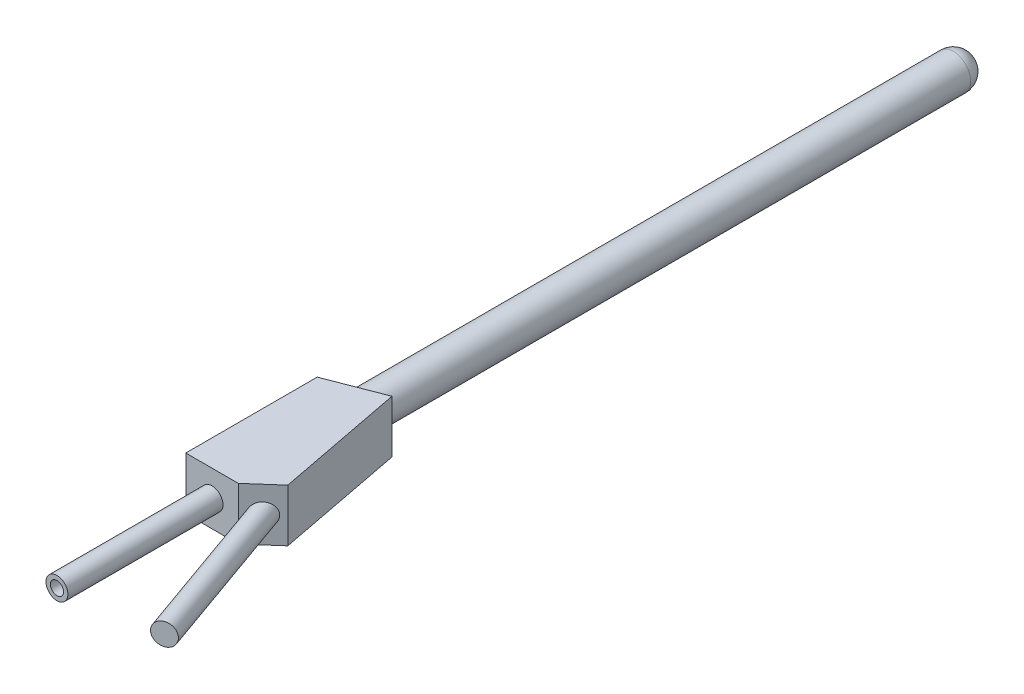
from build123d import *

# Parameters (mm, degrees)
BOSS_EXTRUDE1_DEPTH = 6
SKETCH4_R           = 2
BOSS_EXTRUDE2_DEPTH = 71.5
FILLET1_R           = 2
SKETCH5_R           = 1.25
BOSS_EXTRUDE3_DEPTH = 17.7
SHELL1_T            = -0.5
SKETCH7_R           = 1.25
BOSS_EXTRUDE4_DEPTH = 18.5
BOSS_EXTRUDE5_START = -5
SKETCH7_2_R         = 1.25
BOSS_EXTRUDE5_DEPTH = 5


with BuildPart() as part:
    # Sketch1 → Boss-Extrude1 (new body)
    with BuildSketch(Plane(origin=(0, 0, 0), x_dir=(1, 0, 0), z_dir=(0, 1, 0))):
        Polygon((0, 0), (6.158217776, 2.374100634), (9, -12.354248689), (6, -15), (0, -15), align=None)
    extrude(amount=BOSS_EXTRUDE1_DEPTH)

    # Sketch4 → Boss-Extrude2 (add)
    with BuildSketch(Plane.XY):
        with Locations((3.079108888, 3)):
            Circle(SKETCH4_R)
    extrude(amount=-BOSS_EXTRUDE2_DEPTH)

    # Fillet1
    fillet1_edges = [part.edges().sort_by_distance(p)[0] for p in [
        (1.079108888, 3, -71.5),
    ]]
    fillet(fillet1_edges, radius=FILLET1_R)

    # Sketch5 → Boss-Extrude3 (add)
    with BuildSketch(Plane.XY.offset(15)):
        with Locations((3, 3)):
            Circle(SKETCH5_R)
    extrude(amount=BOSS_EXTRUDE3_DEPTH)

    # Shell1
    shell1_openings = [part.faces().sort_by_distance(p)[0] for p in [
        (3, 3, 32.7),
    ]]
    offset(amount=SHELL1_T, openings=shell1_openings, kind=Kind.INTERSECTION)

    # Sketch7 → Boss-Extrude4 (add)
    with BuildSketch(Plane(origin=(7.5, 6, 13.677124344), x_dir=(0.9424618522341062, 0, -0.33431371058252735), z_dir=(0.33431371058252735, 0, 0.9424618522341062))):
        with Locations((0.000948247, -3)):
            Circle(SKETCH7_R)
    extrude(amount=BOSS_EXTRUDE4_DEPTH)

    # Sketch7<2> → Boss-Extrude5 (add)
    with BuildSketch(Plane(origin=(7.5, 6, 13.677124344), x_dir=(0.9424618522341062, 0, -0.33431371058252735), z_dir=(0.33431371058252735, 0, 0.9424618522341062)).offset(BOSS_EXTRUDE5_START)):
        with Locations((0.000948247, -3)):
            Circle(SKETCH7_2_R)
    extrude(amount=BOSS_EXTRUDE5_DEPTH)


solid = part.part
